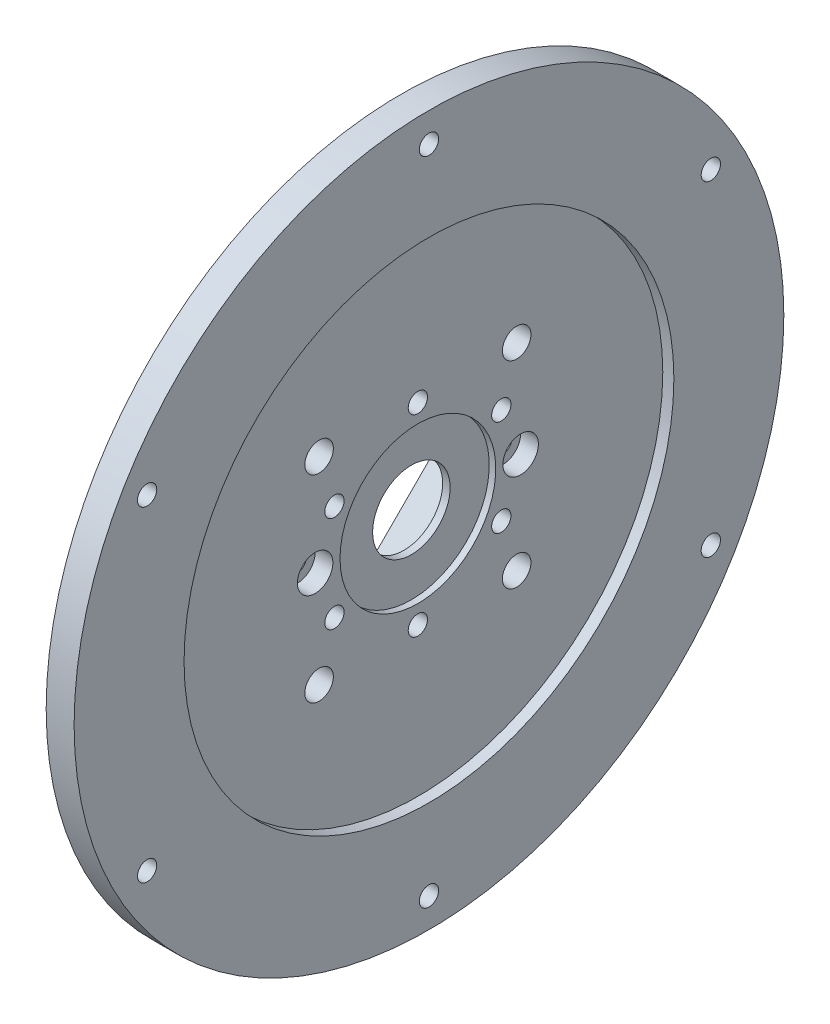
from build123d import *

# Parameters (mm, degrees)
CUT_EXTRUDE1_DEPTH      = 91.852936821
CUT_EXTRUDE1_DEPTH_BACK = 91.852936821
SKETCH4_R               = 1.7272
SKETCH5_R               = 1.5875
CUT_EXTRUDE2_DEPTH      = 92.355937532
SKETCH6_R               = 3.175
CUT_EXTRUDE3_DEPTH      = 3.175
BOSS_EXTRUDE1_REACH     = 93.741
FILLET1_R               = 3.175
SKETCH8_R               = 2.5527
CUT_EXTRUDE4_DEPTH      = 92.741144495


with BuildPart() as part:
    # Sketch2 → Revolve1 (revolve)
    with BuildSketch(Plane.XY):
        Polygon((-0.015199868, 29.999999944), (-1.815199824, 29.999999944), (-11.775199716, 29.999999944), (-13.77519978, 29.999999944), (-13.77519978, 25.4), (-2.000000064, 25.4), (-2.000000064, 11.499999987), (0.500000016, 11.499999987), (0.500000016, 6.937499968), (1.834399684, 6.937499968), (1.834399684, 7.9375), (1.834399684, 13.93649994), (2.999999842, 13.93649994), (2.999999842, 43.824999885), (4.984800038, 43.824999885), (4.984800038, 44.824999885), (4.984800038, 54.936499982), (4.984800038, 63.5), (-0.015199868, 63.5), align=None)
    revolve(axis=Axis((0, 0, 0), (1, 0, 0)))

    # Sketch4 → Cut-Extrude1 (cut, two sides: drawn at the far end of the back side and taken through both)
    with BuildSketch(Plane(origin=(0, 0, 0), x_dir=(0, 0, -1), z_dir=(1, 0, 0)).offset(-CUT_EXTRUDE1_DEPTH_BACK)):
        with Locations((0, 58.238499982)):
            Circle(SKETCH4_R)
        with Locations((50.436020463, 29.119249991)):
            Circle(SKETCH4_R)
        with Locations((50.436020463, -29.119249991)):
            Circle(SKETCH4_R)
        with Locations((0, -58.238499982)):
            Circle(SKETCH4_R)
        with Locations((-50.436020463, -29.119249991)):
            Circle(SKETCH4_R)
        with Locations((-50.436020463, 29.119249991)):
            Circle(SKETCH4_R)
        with Locations((-14.928978871, 8.61924997)):
            Circle(SKETCH4_R)
        with Locations((0, 17.23849994)):
            Circle(SKETCH4_R)
        with Locations((14.928978871, 8.61924997)):
            Circle(SKETCH4_R)
        with Locations((14.928978871, -8.61924997)):
            Circle(SKETCH4_R)
        with Locations((0, -17.23849994)):
            Circle(SKETCH4_R)
        with Locations((-14.928978871, -8.61924997)):
            Circle(SKETCH4_R)
    extrude(amount=CUT_EXTRUDE1_DEPTH + CUT_EXTRUDE1_DEPTH_BACK, mode=Mode.SUBTRACT)

    # Sketch5 → Cut-Extrude2 (cut, through all)
    with BuildSketch(Plane(origin=(2.999999842, 0, 0), x_dir=(0, 0, -1), z_dir=(1, 0, 0))):
        with Locations((-18.385, 0)):
            Circle(SKETCH5_R)
        with Locations((18.385, 0)):
            Circle(SKETCH5_R)
    extrude(amount=-CUT_EXTRUDE2_DEPTH, mode=Mode.SUBTRACT)

    # Sketch6 → Cut-Extrude3 (cut)
    with BuildSketch(Plane(origin=(2.999999842, 0, 0), x_dir=(0, 0, -1), z_dir=(1, 0, 0))):
        with Locations((-18.385, 0)):
            Circle(SKETCH6_R)
        with Locations((18.385, 0)):
            Circle(SKETCH6_R)
    extrude(amount=-CUT_EXTRUDE3_DEPTH, mode=Mode.SUBTRACT)

    # Sketch7 → Boss-Extrude1 (add, up to next)
    with BuildSketch(Plane.ZY.offset(13.77519978), mode=Mode.PRIVATE) as boss_extrude1_sk1:
        with BuildLine():
            ThreePointArc((25.213720876, 3.070550371), (17.960512242, 17.960512242), (3.070550371, 25.213720876))
            Line((3.070550371, 25.213720876), (25.213720876, 3.070550371))
        make_face()
    boss_extrude1_tool1 = extrude(boss_extrude1_sk1.sketch, amount=-BOSS_EXTRUDE1_REACH, mode=Mode.PRIVATE) - part.part
    # Sketch7 → Boss-Extrude1 (add, up to next)
    with BuildSketch(Plane.ZY.offset(13.77519978), mode=Mode.PRIVATE) as boss_extrude1_sk2:
        with BuildLine():
            Line((-25.213720876, 3.070550371), (-3.070550371, 25.213720876))
            ThreePointArc((-3.070550371, 25.213720876), (-17.960512242, 17.960512242), (-25.213720876, 3.070550371))
        make_face()
    boss_extrude1_tool2 = extrude(boss_extrude1_sk2.sketch, amount=-BOSS_EXTRUDE1_REACH, mode=Mode.PRIVATE) - part.part
    # Sketch7 → Boss-Extrude1 (add, up to next)
    with BuildSketch(Plane.ZY.offset(13.77519978), mode=Mode.PRIVATE) as boss_extrude1_sk3:
        with BuildLine():
            ThreePointArc((3.070550371, -25.213720876), (17.960512242, -17.960512242), (25.213720876, -3.070550371))
            Line((25.213720876, -3.070550371), (3.070550371, -25.213720876))
        make_face()
    boss_extrude1_tool3 = extrude(boss_extrude1_sk3.sketch, amount=-BOSS_EXTRUDE1_REACH, mode=Mode.PRIVATE) - part.part
    # Sketch7 → Boss-Extrude1 (add, up to next)
    with BuildSketch(Plane.ZY.offset(13.77519978), mode=Mode.PRIVATE) as boss_extrude1_sk4:
        with BuildLine():
            Line((-3.070550371, -25.213720876), (-25.213720876, -3.070550371))
            ThreePointArc((-25.213720876, -3.070550371), (-17.960512242, -17.960512242), (-3.070550371, -25.213720876))
        make_face()
    boss_extrude1_tool4 = extrude(boss_extrude1_sk4.sketch, amount=-BOSS_EXTRUDE1_REACH, mode=Mode.PRIVATE) - part.part
    add(boss_extrude1_tool1.solids().sort_by_distance((-13.7752, 15.684318, 15.684318))[0])
    add(boss_extrude1_tool2.solids().sort_by_distance((-13.7752, 15.684318, -15.684318))[0])
    add(boss_extrude1_tool3.solids().sort_by_distance((-13.7752, -15.684318, 15.684318))[0])
    add(boss_extrude1_tool4.solids().sort_by_distance((-13.7752, -15.684318, -15.684318))[0])

    # Fillet1
    fillet1_edges = [part.edges().sort_by_distance(p)[0] for p in [
        (-7.887599922, -25.213720876, -3.070550371),
        (-7.887599922, -25.213720876, 3.070550371),
        (-7.887599922, -3.070550371, 25.213720876),
        (-7.887599922, 3.070550371, 25.213720876),
        (-7.887599922, -3.070550371, -25.213720876),
        (-7.887599922, 3.070550371, -25.213720876),
        (-7.887599922, 25.213720876, 3.070550371),
        (-7.887599922, 25.213720876, -3.070550371),
    ]]
    fillet(fillet1_edges, radius=FILLET1_R)

    # Sketch8 → Cut-Extrude4 (cut, through all)
    with BuildSketch(Plane.ZY.offset(13.77519978)):
        with Locations((17.67766951, 17.67766951)):
            Circle(SKETCH8_R)
        with Locations((17.67766951, -17.67766951)):
            Circle(SKETCH8_R)
        with Locations((-17.67766951, -17.67766951)):
            Circle(SKETCH8_R)
        with Locations((-17.67766951, 17.67766951)):
            Circle(SKETCH8_R)
    extrude(amount=-CUT_EXTRUDE4_DEPTH, mode=Mode.SUBTRACT)


solid = part.part
